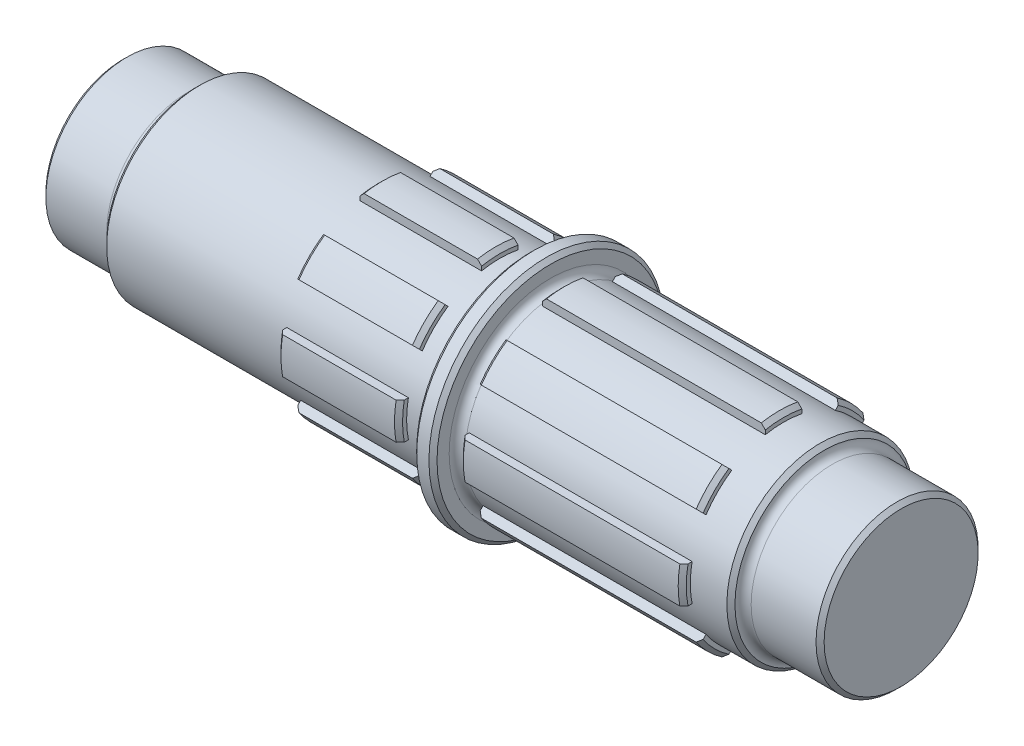
from build123d import *
from build123d.topology import SkipClean

# Parameters (mm, degrees)
CHAMFER1_SIZE      = 1
CUT_EXTRUDE1_REACH = 137.362
CHAMFER2_SIZE      = 1
CUT_EXTRUDE3_DEPTH = 55
FILLET1_R          = 2


with BuildPart() as part:
    # Sketch1 → Revolve1 (revolve)
    with BuildSketch(Plane.XY, mode=Mode.PRIVATE) as revolve1_sk:
        Polygon((-119.281437126, 0), (-119.281437126, 20), (-101.281437126, 20), (-101.281437126, 23), (-56.281437126, 23), (-56.281437126, 25), (-26.281437126, 25), (-26.281437126, 23), (-18.781437126, 23), (-18.781437126, 29), (-13.781437126, 29), (-13.781437126, 23), (-11.281437126, 23), (-11.281437126, 25), (43.718562874, 25), (43.718562874, 23), (53.718562874, 23), (53.718562874, 20), (72.718562874, 20), (72.718562874, 0), align=None)
    revolve(revolve1_sk.sketch.rotate(Axis((-133.413173653, 0, 0), (1, 0, 0)), 90), axis=Axis((-133.413173653, 0, 0), (1, 0, 0)))

    # Chamfer1
    chamfer1_edges = [part.edges().sort_by_distance(p)[0] for p in [
        (72.718562874, 0, -20),
        (53.718562874, 0, -23),
        (43.718562874, 0, -25),
        (-13.781437126, 0, -29),
        (-18.781437126, 0, -29),
        (-26.281437126, 0, -25),
        (-56.281437126, 0, -25),
        (-101.281437126, 0, -23),
        (-119.281437126, 0, -20),
    ]]
    chamfer(chamfer1_edges, length=CHAMFER1_SIZE)

    # Cut-Extrude1: up to this face of the body (flat: up to its plane)
    cut_extrude1_end = Plane(part.part.faces().sort_by_distance((-26.281437126, 0, -23.32117749))[0])
    # Sketch2 → Cut-Extrude1 (cut, up to the picked face)
    with BuildSketch(Plane.ZY.offset(56.281437126), mode=Mode.PRIVATE) as cut_extrude1_sk1:
        with BuildLine():
            Line((-4.5, 24.591665255), (-4.5, 22.555487137))
            ThreePointArc((-4.5, 22.555487137), (-8.801718944, 21.249229248), (-12.767157392, 19.131118423))
            Line((-12.767157392, 19.131118423), (-14.206952747, 20.570913778))
            ThreePointArc((-14.206952747, 20.570913778), (-9.567085809, 23.096988313), (-4.5, 24.591665255))
        make_face()
    cut_extrude1_tool1 = split(extrude(cut_extrude1_sk1.sketch, amount=-CUT_EXTRUDE1_REACH, mode=Mode.PRIVATE), bisect_by=cut_extrude1_end, keep=Keep.BOTH, mode=Mode.PRIVATE)
    # Sketch2 → Cut-Extrude1 (cut, up to the picked face)
    with BuildSketch(Plane.ZY.offset(56.281437126), mode=Mode.PRIVATE) as cut_extrude1_sk2:
        with BuildLine():
            Line((4.5, 24.591665255), (4.5, 22.555487137))
            ThreePointArc((4.5, 22.555487137), (8.801718944, 21.249229248), (12.767157392, 19.131118423))
            Line((12.767157392, 19.131118423), (14.206952747, 20.570913778))
            ThreePointArc((14.206952747, 20.570913778), (9.567085809, 23.096988313), (4.5, 24.591665255))
        make_face()
    cut_extrude1_tool2 = split(extrude(cut_extrude1_sk2.sketch, amount=-CUT_EXTRUDE1_REACH, mode=Mode.PRIVATE), bisect_by=cut_extrude1_end, keep=Keep.BOTH, mode=Mode.PRIVATE)
    # Sketch2 → Cut-Extrude1 (cut, up to the picked face)
    with BuildSketch(Plane.ZY.offset(56.281437126), mode=Mode.PRIVATE) as cut_extrude1_sk3:
        with BuildLine():
            Line((20.570913778, 14.206952747), (19.131118423, 12.767157392))
            ThreePointArc((19.131118423, 12.767157392), (21.249229248, 8.801718944), (22.555487137, 4.5))
            Line((22.555487137, 4.5), (24.591665255, 4.5))
            ThreePointArc((24.591665255, 4.5), (23.096988313, 9.567085809), (20.570913778, 14.206952747))
        make_face()
    cut_extrude1_tool3 = split(extrude(cut_extrude1_sk3.sketch, amount=-CUT_EXTRUDE1_REACH, mode=Mode.PRIVATE), bisect_by=cut_extrude1_end, keep=Keep.BOTH, mode=Mode.PRIVATE)
    # Sketch2 → Cut-Extrude1 (cut, up to the picked face)
    with BuildSketch(Plane.ZY.offset(56.281437126), mode=Mode.PRIVATE) as cut_extrude1_sk4:
        with BuildLine():
            Line((24.591665255, -4.5), (22.555487137, -4.5))
            ThreePointArc((22.555487137, -4.5), (21.249229248, -8.801718944), (19.131118423, -12.767157392))
            Line((19.131118423, -12.767157392), (20.570913778, -14.206952747))
            ThreePointArc((20.570913778, -14.206952747), (23.096988313, -9.567085809), (24.591665255, -4.5))
        make_face()
    cut_extrude1_tool4 = split(extrude(cut_extrude1_sk4.sketch, amount=-CUT_EXTRUDE1_REACH, mode=Mode.PRIVATE), bisect_by=cut_extrude1_end, keep=Keep.BOTH, mode=Mode.PRIVATE)
    # Sketch2 → Cut-Extrude1 (cut, up to the picked face)
    with BuildSketch(Plane.ZY.offset(56.281437126), mode=Mode.PRIVATE) as cut_extrude1_sk5:
        with BuildLine():
            Line((14.206952747, -20.570913778), (12.767157392, -19.131118423))
            ThreePointArc((12.767157392, -19.131118423), (8.801718944, -21.249229248), (4.5, -22.555487137))
            Line((4.5, -22.555487137), (4.5, -24.591665255))
            ThreePointArc((4.5, -24.591665255), (9.567085809, -23.096988313), (14.206952747, -20.570913778))
        make_face()
    cut_extrude1_tool5 = split(extrude(cut_extrude1_sk5.sketch, amount=-CUT_EXTRUDE1_REACH, mode=Mode.PRIVATE), bisect_by=cut_extrude1_end, keep=Keep.BOTH, mode=Mode.PRIVATE)
    # Sketch2 → Cut-Extrude1 (cut, up to the picked face)
    with BuildSketch(Plane.ZY.offset(56.281437126), mode=Mode.PRIVATE) as cut_extrude1_sk6:
        with BuildLine():
            Line((-4.5, -24.591665255), (-4.5, -22.555487137))
            ThreePointArc((-4.5, -22.555487137), (-8.801718944, -21.249229248), (-12.767157392, -19.131118423))
            Line((-12.767157392, -19.131118423), (-14.206952747, -20.570913778))
            ThreePointArc((-14.206952747, -20.570913778), (-9.567085809, -23.096988313), (-4.5, -24.591665255))
        make_face()
    cut_extrude1_tool6 = split(extrude(cut_extrude1_sk6.sketch, amount=-CUT_EXTRUDE1_REACH, mode=Mode.PRIVATE), bisect_by=cut_extrude1_end, keep=Keep.BOTH, mode=Mode.PRIVATE)
    # Sketch2 → Cut-Extrude1 (cut, up to the picked face)
    with BuildSketch(Plane.ZY.offset(56.281437126), mode=Mode.PRIVATE) as cut_extrude1_sk7:
        with BuildLine():
            Line((-20.570913778, -14.206952747), (-19.131118423, -12.767157392))
            ThreePointArc((-19.131118423, -12.767157392), (-21.249229248, -8.801718944), (-22.555487137, -4.5))
            Line((-22.555487137, -4.5), (-24.591665255, -4.5))
            ThreePointArc((-24.591665255, -4.5), (-23.096988313, -9.567085809), (-20.570913778, -14.206952747))
        make_face()
    cut_extrude1_tool7 = split(extrude(cut_extrude1_sk7.sketch, amount=-CUT_EXTRUDE1_REACH, mode=Mode.PRIVATE), bisect_by=cut_extrude1_end, keep=Keep.BOTH, mode=Mode.PRIVATE)
    # Sketch2 → Cut-Extrude1 (cut, up to the picked face)
    with BuildSketch(Plane.ZY.offset(56.281437126), mode=Mode.PRIVATE) as cut_extrude1_sk8:
        with BuildLine():
            Line((-24.591665255, 4.5), (-22.555487137, 4.5))
            ThreePointArc((-22.555487137, 4.5), (-21.249229248, 8.801718944), (-19.131118423, 12.767157392))
            Line((-19.131118423, 12.767157392), (-20.570913778, 14.206952747))
            ThreePointArc((-20.570913778, 14.206952747), (-23.096988313, 9.567085809), (-24.591665255, 4.5))
        make_face()
    cut_extrude1_tool8 = split(extrude(cut_extrude1_sk8.sketch, amount=-CUT_EXTRUDE1_REACH, mode=Mode.PRIVATE), bisect_by=cut_extrude1_end, keep=Keep.BOTH, mode=Mode.PRIVATE)
    add(cut_extrude1_tool1.solids().sort_by(Axis((-56.281437, 22.043779, -9.130832), (1, 0, 0)))[0], mode=Mode.SUBTRACT)
    add(cut_extrude1_tool2.solids().sort_by(Axis((-56.281437, 22.043779, 9.130832), (1, 0, 0)))[0], mode=Mode.SUBTRACT)
    add(cut_extrude1_tool3.solids().sort_by(Axis((-56.281437, 9.130832, 22.043779), (1, 0, 0)))[0], mode=Mode.SUBTRACT)
    add(cut_extrude1_tool4.solids().sort_by(Axis((-56.281437, -9.130832, 22.043779), (1, 0, 0)))[0], mode=Mode.SUBTRACT)
    add(cut_extrude1_tool5.solids().sort_by(Axis((-56.281437, -22.043779, 9.130832), (1, 0, 0)))[0], mode=Mode.SUBTRACT)
    add(cut_extrude1_tool6.solids().sort_by(Axis((-56.281437, -22.043779, -9.130832), (1, 0, 0)))[0], mode=Mode.SUBTRACT)
    add(cut_extrude1_tool7.solids().sort_by(Axis((-56.281437, -9.130832, -22.043779), (1, 0, 0)))[0], mode=Mode.SUBTRACT)
    add(cut_extrude1_tool8.solids().sort_by(Axis((-56.281437, 9.130832, -22.043779), (1, 0, 0)))[0], mode=Mode.SUBTRACT)

    # Chamfer2
    chamfer2_edges = [part.edges().sort_by_distance(p)[0] for p in [
        (-11.281437126, 0, -25),
    ]]
    chamfer(chamfer2_edges, length=CHAMFER2_SIZE)

    # Sketch4 → Cut-Extrude3 (cut)
    with SkipClean():  # the faces are left unmerged after this step: merging them gives an invalid solid
        with BuildSketch(Plane(origin=(43.718562874, 0, 0), x_dir=(0, 0, -1), z_dir=(1, 0, 0))):
            with BuildLine():
                Line((-4.5, 24.591665255), (-4.5, 22.555487137))
                ThreePointArc((-4.5, 22.555487137), (-8.801718944, 21.249229248), (-12.767157392, 19.131118423))
                Line((-12.767157392, 19.131118423), (-14.206952747, 20.570913778))
                ThreePointArc((-14.206952747, 20.570913778), (-9.567085809, 23.096988313), (-4.5, 24.591665255))
            make_face()
            with BuildLine():
                Line((4.5, 24.591665255), (4.5, 22.555487137))
                ThreePointArc((4.5, 22.555487137), (8.801718944, 21.249229248), (12.767157392, 19.131118423))
                Line((12.767157392, 19.131118423), (14.206952747, 20.570913778))
                ThreePointArc((14.206952747, 20.570913778), (9.567085809, 23.096988313), (4.5, 24.591665255))
            make_face()
            with BuildLine():
                Line((20.570913778, 14.206952747), (19.131118423, 12.767157392))
                ThreePointArc((19.131118423, 12.767157392), (21.249229248, 8.801718944), (22.555487137, 4.5))
                Line((22.555487137, 4.5), (24.591665255, 4.5))
                ThreePointArc((24.591665255, 4.5), (23.096988313, 9.567085809), (20.570913778, 14.206952747))
            make_face()
            with BuildLine():
                Line((24.591665255, -4.5), (22.555487137, -4.5))
                ThreePointArc((22.555487137, -4.5), (21.249229248, -8.801718944), (19.131118423, -12.767157392))
                Line((19.131118423, -12.767157392), (20.570913778, -14.206952747))
                ThreePointArc((20.570913778, -14.206952747), (23.096988313, -9.567085809), (24.591665255, -4.5))
            make_face()
            with BuildLine():
                Line((14.206952747, -20.570913778), (12.767157392, -19.131118423))
                ThreePointArc((12.767157392, -19.131118423), (8.801718944, -21.249229248), (4.5, -22.555487137))
                Line((4.5, -22.555487137), (4.5, -24.591665255))
                ThreePointArc((4.5, -24.591665255), (9.567085809, -23.096988313), (14.206952747, -20.570913778))
            make_face()
            with BuildLine():
                Line((-4.5, -24.591665255), (-4.5, -22.555487137))
                ThreePointArc((-4.5, -22.555487137), (-8.801718944, -21.249229248), (-12.767157392, -19.131118423))
                Line((-12.767157392, -19.131118423), (-14.206952747, -20.570913778))
                ThreePointArc((-14.206952747, -20.570913778), (-9.567085809, -23.096988313), (-4.5, -24.591665255))
            make_face()
            with BuildLine():
                Line((-20.570913778, -14.206952747), (-19.131118423, -12.767157392))
                ThreePointArc((-19.131118423, -12.767157392), (-21.249229248, -8.801718944), (-22.555487137, -4.5))
                Line((-22.555487137, -4.5), (-24.591665255, -4.5))
                ThreePointArc((-24.591665255, -4.5), (-23.096988313, -9.567085809), (-20.570913778, -14.206952747))
            make_face()
            with BuildLine():
                Line((-24.591665255, 4.5), (-22.555487137, 4.5))
                ThreePointArc((-22.555487137, 4.5), (-21.249229248, 8.801718944), (-19.131118423, 12.767157392))
                Line((-19.131118423, 12.767157392), (-20.570913778, 14.206952747))
                ThreePointArc((-20.570913778, 14.206952747), (-23.096988313, 9.567085809), (-24.591665255, 4.5))
            make_face()
        extrude(amount=-CUT_EXTRUDE3_DEPTH, mode=Mode.SUBTRACT)

    # Fillet1
    fillet1_edges = [part.edges().sort_by_distance(p)[0] for p in [
        (53.718562874, 0, -20),
        (-13.781437126, 0, -23),
        (-18.781437126, 0, -23),
        (-101.281437126, 0, -20),
    ]]
    fillet(fillet1_edges, radius=FILLET1_R - 0.0001)  # a hair under: the kernel refuses the full size


solid = part.part
